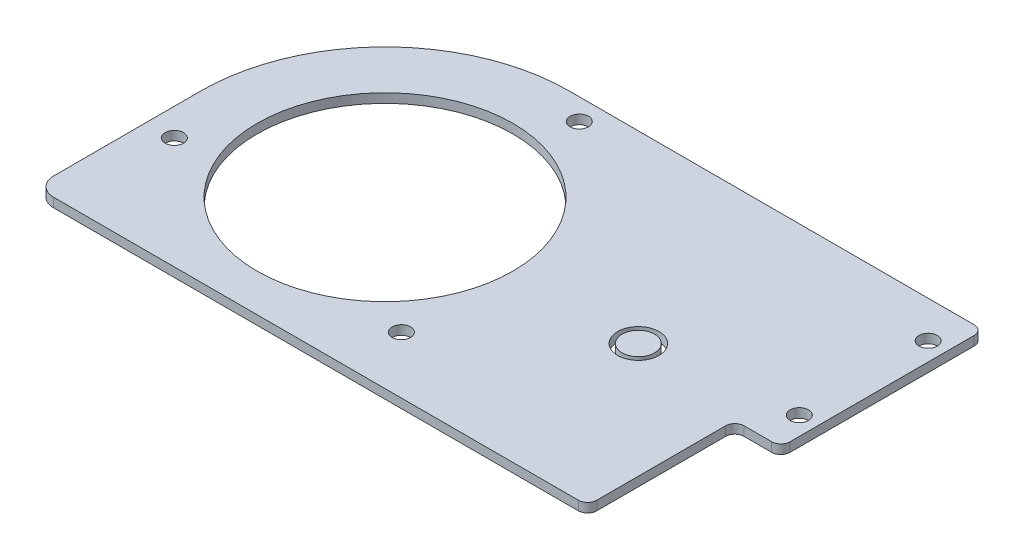
from build123d import *

# Parameters (mm, degrees)
SKETCH1_R           = 88.265
SKETCH1_R_2         = 6.35
BOSS_EXTRUDE1_DEPTH = 6.35
SKETCH6_R           = 14.2875
SKETCH6_R_2         = 11.176
CUT_EXTRUDE1_DEPTH  = 28.448


with BuildPart() as part:
    # Sketch1 → Boss-Extrude1 (new body)
    with BuildSketch(Plane(origin=(0, 0, 0), x_dir=(1, 0, 0), z_dir=(0, 1, 0))):
        with BuildLine():
            Line((279.4, 127), (0, 127))
            ThreePointArc((0, 127), (-89.802561211, 89.802561211), (-127, 0))
            Line((-127, 0), (-127, -101.6))
            ThreePointArc((-127, -101.6), (-123.280256121, -110.580256121), (-114.3, -114.3))
            Line((-114.3, -114.3), (247.65, -114.3))
            ThreePointArc((247.65, -114.3), (252.140128061, -112.440128061), (254, -107.95))
            Line((254, -107.95), (254, -19.05))
            ThreePointArc((254, -19.05), (255.859871939, -14.559871939), (260.35, -12.7))
            Line((260.35, -12.7), (279.4, -12.7))
            ThreePointArc((279.4, -12.7), (283.890128061, -10.840128061), (285.75, -6.35))
            Line((285.75, -6.35), (285.75, 120.65))
            ThreePointArc((285.75, 120.65), (283.890128061, 125.140128061), (279.4, 127))
        make_face()
        Circle(SKETCH1_R, mode=Mode.SUBTRACT)
        with Locations((-108.072773191, -37.212440054)):
            Circle(SKETCH1_R_2, mode=Mode.SUBTRACT)
        with Locations((21.809468172, 112.199987068)):
            Circle(SKETCH1_R_2, mode=Mode.SUBTRACT)
        with Locations((86.263305019, -74.987547014)):
            Circle(SKETCH1_R_2, mode=Mode.SUBTRACT)
        with Locations((273.05, 101.6)):
            Circle(SKETCH1_R_2, mode=Mode.SUBTRACT)
        with Locations((273.05, 12.7)):
            Circle(SKETCH1_R_2, mode=Mode.SUBTRACT)
    extrude(amount=BOSS_EXTRUDE1_DEPTH)

    # Sketch6 → Cut-Extrude1 (cut)
    with BuildSketch(Plane(origin=(0, 0, 0), x_dir=(1, 0, 0), z_dir=(0, 1, 0))):
        with Locations((174.752, 0)):
            Circle(SKETCH6_R)
        with Locations((174.752, 0)):
            Circle(SKETCH6_R_2, mode=Mode.SUBTRACT)
    extrude(amount=CUT_EXTRUDE1_DEPTH, mode=Mode.SUBTRACT)


with BuildPart() as cut_extrude1_piece_1:
    # of the separate pieces the step leaves, piece 1, a body of its own (cut_extrude1_pieces)
    add(part.part.solids().sort_by_distance((279.4, 0, -127))[0])


with BuildPart() as cut_extrude1_piece_2:
    # of the separate pieces the step leaves, piece 2, a body of its own (cut_extrude1_pieces)
    add(part.part.solids().sort_by_distance((185.928, 0, 0))[0])


solid = Compound([cut_extrude1_piece_1.part, cut_extrude1_piece_2.part])
